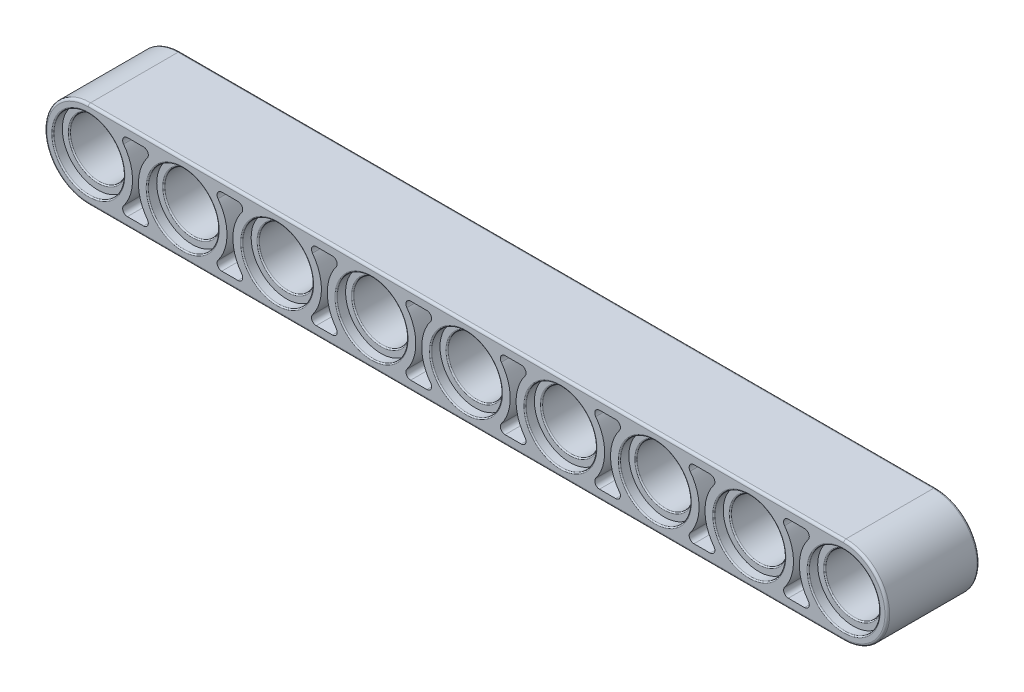
from build123d import *

# Parameters (mm, degrees)
BODY_DEPTH                       = 3.9
SKETCH2_R                        = 2.4
HOLE_DEPTH                       = 68.913106246
SKETCH4_R                        = 3
COUNTER_BORE_DEPTH               = 0.8
FILLET5_R                        = 0.1
FILLET3_R                        = 0.2
NO_OF_HOLES_PATTERN_COUNT        = 9
NO_OF_HOLES_PATTERN_PITCH        = 8
FILLET5_OF_NO_OF_HOLES_PATTERN_R = 0.1
EXTRUDE5_DEPTH                   = 2
FILLET1_R                        = 0.4
NO_OF_RIBS_PATTERN_COUNT         = 8
NO_OF_RIBS_PATTERN_PITCH         = 8
FILLET1_OF_NO_OF_RIBS_PATTERN_R  = 0.4


# Read off the part's stored shape, not the designer's step: Mirror3
with BuildPart() as part:
    # Sketch1 → Body (new body)
    with BuildSketch(Plane.XY):
        with BuildLine():
            Line((0, -3.7), (64, -3.7))
            ThreePointArc((64, -3.7), (67.7, 0), (64, 3.7))
            Line((64, 3.7), (0, 3.7))
            ThreePointArc((0, 3.7), (-3.7, 0), (0, -3.7))
        make_face()
    extrude(amount=BODY_DEPTH)

    # Sketch2 → Hole (cut, through all)
    with BuildSketch(Plane.XY.offset(3.9)):
        Circle(SKETCH2_R)
    hole = extrude(amount=-HOLE_DEPTH, mode=Mode.SUBTRACT)

    # Sketch4 → counter bore (cut)
    with BuildSketch(Plane(origin=(0, 0, 0), x_dir=(-1, 0, 0), z_dir=(0, 0, -1))):
        Circle(SKETCH4_R)
    counter_bore = extrude(amount=-COUNTER_BORE_DEPTH, mode=Mode.SUBTRACT)

    # Fillet5
    fillet5_edges = [part.edges().sort_by_distance(p)[0] for p in [
        (3, 0, 0),
        (-2.4, 0, 0.8),
    ]]
    fillet(fillet5_edges, radius=FILLET5_R)

    # Fillet3
    fillet3_edges = [part.edges().sort_by_distance(p)[0] for p in [
        (32, -3.7, 0),
        (67.7, 0, 0),
        (32, 3.7, 0),
        (-3.7, 0, 0),
    ]]
    fillet(fillet3_edges, radius=FILLET3_R)

    # no of holes pattern: Hole, counter bore ×9
    with Locations(*[(i * NO_OF_HOLES_PATTERN_PITCH, 0, 0) for i in range(1, NO_OF_HOLES_PATTERN_COUNT)]):
        add(hole, mode=Mode.SUBTRACT)
        add(counter_bore, mode=Mode.SUBTRACT)

    # Fillet5 of no of holes pattern
    fillet5_of_no_of_holes_pattern_edges = [part.edges().sort_by_distance(p)[0] for p in [
        (11, 0, 0),
        (5.6, 0, 0.8),
        (19, 0, 0),
        (13.6, 0, 0.8),
        (27, 0, 0),
        (21.6, 0, 0.8),
        (35, 0, 0),
        (29.6, 0, 0.8),
        (43, 0, 0),
        (37.6, 0, 0.8),
        (51, 0, 0),
        (45.6, 0, 0.8),
        (59, 0, 0),
        (53.6, 0, 0.8),
        (67, 0, 0),
        (61.6, 0, 0.8),
    ]]
    fillet(fillet5_of_no_of_holes_pattern_edges, radius=FILLET5_OF_NO_OF_HOLES_PATTERN_R)

    # Sketch6 → Extrude5 (cut)
    with BuildSketch(Plane.XY):
        with BuildLine():
            Line((2.377498686, -2.9), (5.622501314, -2.9))
            ThreePointArc((5.622501314, -2.9), (4.25, 0), (5.622501314, 2.9))
            Line((5.622501314, 2.9), (2.377498686, 2.9))
            ThreePointArc((2.377498686, 2.9), (3.75, 0), (2.377498686, -2.9))
        make_face()
    extrude5 = extrude(amount=EXTRUDE5_DEPTH, mode=Mode.SUBTRACT)

    # Fillet1
    fillet1_edges = [part.edges().sort_by_distance(p)[0] for p in [
        (2.377498686, 2.9, 1),
        (2.377498686, -2.9, 1),
        (5.622501314, -2.9, 1),
        (5.622501314, 2.9, 1),
    ]]
    fillet(fillet1_edges, radius=FILLET1_R)

    # no of ribs pattern: Extrude5 ×8
    with Locations(*[(i * NO_OF_RIBS_PATTERN_PITCH, 0, 0) for i in range(1, NO_OF_RIBS_PATTERN_COUNT)]):
        add(extrude5, mode=Mode.SUBTRACT)

    # Fillet1 of no of ribs pattern
    fillet1_of_no_of_ribs_pattern_edges = [part.edges().sort_by_distance(p)[0] for p in [
        (10.377498686, 2.9, 1),
        (10.377498686, -2.9, 1),
        (13.622501314, -2.9, 1),
        (13.622501314, 2.9, 1),
        (18.377498686, 2.9, 1),
        (18.377498686, -2.9, 1),
        (21.622501314, -2.9, 1),
        (21.622501314, 2.9, 1),
        (26.377498686, 2.9, 1),
        (26.377498686, -2.9, 1),
        (29.622501314, -2.9, 1),
        (29.622501314, 2.9, 1),
        (34.377498686, 2.9, 1),
        (34.377498686, -2.9, 1),
        (37.622501314, -2.9, 1),
        (37.622501314, 2.9, 1),
        (42.377498686, 2.9, 1),
        (42.377498686, -2.9, 1),
        (45.622501314, -2.9, 1),
        (45.622501314, 2.9, 1),
        (50.377498686, 2.9, 1),
        (50.377498686, -2.9, 1),
        (53.622501314, -2.9, 1),
        (53.622501314, 2.9, 1),
        (58.377498686, 2.9, 1),
        (58.377498686, -2.9, 1),
        (61.622501314, -2.9, 1),
        (61.622501314, 2.9, 1),
    ]]
    fillet(fillet1_of_no_of_ribs_pattern_edges, radius=FILLET1_OF_NO_OF_RIBS_PATTERN_R)

    # Mirror3: part across plane


with BuildPart() as part_1:
    add(part.part)
    add(part.part.mirror(Plane.XY.offset(3.9)))


solid = part_1.part
